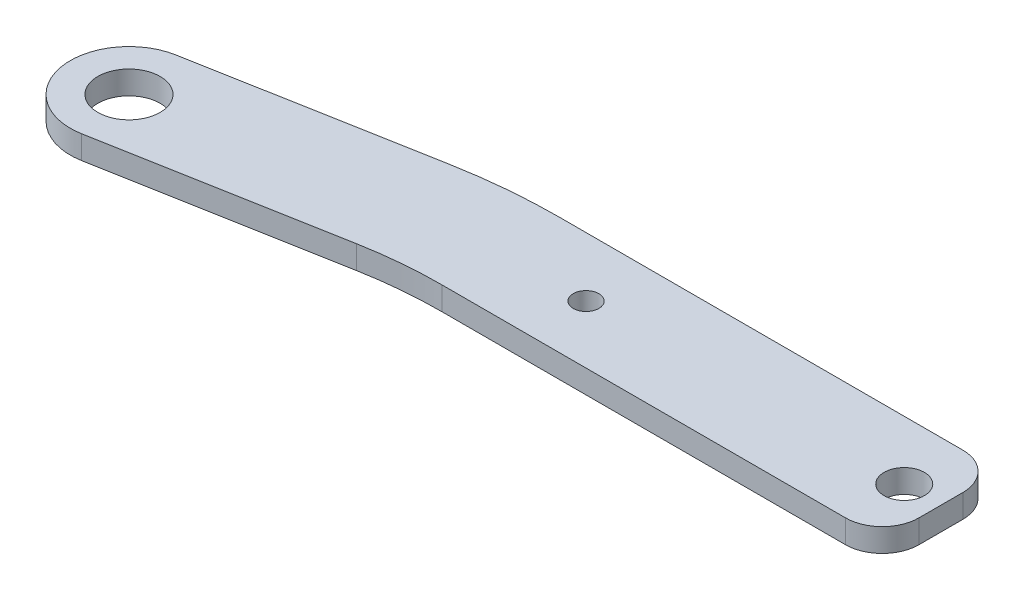
from build123d import *

# Parameters (mm, degrees)
SKETCH1_R           = 4.25
SKETCH1_R_2         = 2.75
BOSS_EXTRUDE1_DEPTH = 3.175
SKETCH2_R           = 1.75
CUT_EXTRUDE1_DEPTH  = 105.966469474


with BuildPart() as part:
    # Sketch1 → Boss-Extrude1 (new body)
    with BuildSketch(Plane(origin=(0, 0, 0), x_dir=(1, 0, 0), z_dir=(0, 1, 0))):
        with BuildLine():
            Line((-1.428652306, 7.871400929), (30.290003092, 13.628308828))
            ThreePointArc((30.290003092, 13.628308828), (37.048664607, 14.543961024), (43.8622, 14.85))
            Line((43.8622, 14.85), (98.8622, 14.85))
            ThreePointArc((98.8622, 14.85), (102.397733906, 13.385533906), (103.8622, 9.85))
            Line((103.8622, 9.85), (103.8622, 3.85))
            ThreePointArc((103.8622, 3.85), (102.397733906, 0.314466094), (98.8622, -1.15))
            Line((98.8622, -1.15), (43.8622, -1.15))
            ThreePointArc((43.8622, -1.15), (38.483093111, -1.391609718), (33.147307705, -2.114493031))
            Line((33.147307705, -2.114493031), (1.428652306, -7.871400929))
            ThreePointArc((1.428652306, -7.871400929), (-7.871400929, -1.428652306), (-1.428652306, 7.871400929))
        make_face()
        Circle(SKETCH1_R, mode=Mode.SUBTRACT)
        with Locations((98.8622, 6.85)):
            Circle(SKETCH1_R_2, mode=Mode.SUBTRACT)
    extrude(amount=BOSS_EXTRUDE1_DEPTH)

    # Sketch2 → Cut-Extrude1 (cut, through all)
    with BuildSketch(Plane.XZ):
        with Locations((55.5622, -6.759371014)):
            Circle(SKETCH2_R)
    extrude(amount=-CUT_EXTRUDE1_DEPTH, mode=Mode.SUBTRACT)


solid = part.part
